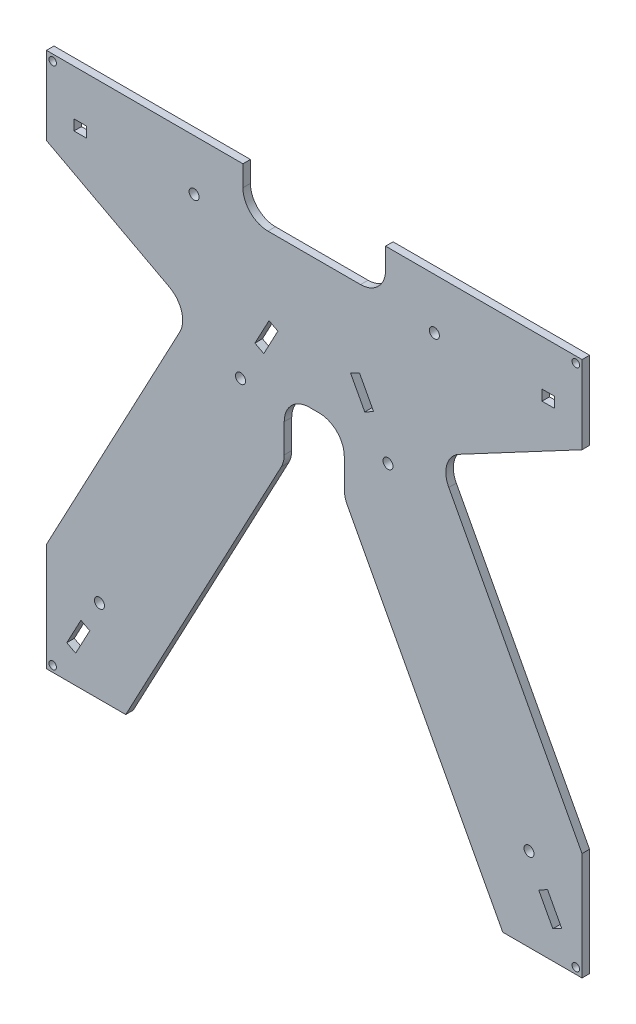
from build123d import *

# Parameters (mm, degrees)
SKETCH1_R           = 1.5
SKETCH1_R_2         = 2
SKETCH1_W           = 5
SKETCH1_H           = 4.2
BOSS_EXTRUDE1_DEPTH = 3
SKETCH3_W           = 57
SKETCH3_H           = 18.3
CUT_EXTRUDE2_DEPTH  = 152.350586388
FILLET1_R           = 10


with BuildPart() as part:
    # Sketch1 → Boss-Extrude1 (new body)
    with BuildSketch(Plane.XY):
        Polygon((89, 107), (107, 107), (107, -107), (-107, -107), (-107, 107), (-89, 107), align=None)
        with Locations((-104.5, 104.5)):
            Circle(SKETCH1_R, mode=Mode.SUBTRACT)
        with Locations((104.5, 104.5)):
            Circle(SKETCH1_R, mode=Mode.SUBTRACT)
        with Locations((104.5, 0)):
            Circle(SKETCH1_R, mode=Mode.SUBTRACT)
        with Locations((-48, 86.7)):
            Circle(SKETCH1_R_2, mode=Mode.SUBTRACT)
        with Locations((0, 104.5)):
            Circle(SKETCH1_R, mode=Mode.SUBTRACT)
        with Locations((104.5, -104.5)):
            Circle(SKETCH1_R, mode=Mode.SUBTRACT)
        Circle(SKETCH1_R_2, mode=Mode.SUBTRACT)
        with Locations((0, -104.5)):
            Circle(SKETCH1_R, mode=Mode.SUBTRACT)
        with Locations((-104.5, -104.5)):
            Circle(SKETCH1_R, mode=Mode.SUBTRACT)
        with Locations((-104.5, 0)):
            Circle(SKETCH1_R, mode=Mode.SUBTRACT)
        with Locations((48, 86.7)):
            Circle(SKETCH1_R_2, mode=Mode.SUBTRACT)
        with Locations((29.454403004, 32.277770019)):
            Circle(SKETCH1_R_2, mode=Mode.SUBTRACT)
        with Locations((85.823626955, -73.658581585)):
            Circle(SKETCH1_R_2, mode=Mode.SUBTRACT)
        with Locations((-85.823626955, -73.658581585)):
            Circle(SKETCH1_R_2, mode=Mode.SUBTRACT)
        with Locations((-29.454403004, 32.277770019)):
            Circle(SKETCH1_R_2, mode=Mode.SUBTRACT)
        with Locations((-93.5, 86.7)):
            Rectangle(SKETCH1_W, SKETCH1_H, mode=Mode.SUBTRACT)
        with Locations((93.5, 86.7)):
            Rectangle(SKETCH1_W, SKETCH1_H, mode=Mode.SUBTRACT)
        Polygon((93.22615521, -83.312729679), (98.863077605, -93.90636484), (95.331865885, -95.785338971), (89.69494349, -85.191703811), align=None, mode=Mode.SUBTRACT)
        Polygon((18.067189942, 57.935739126), (23.704112337, 47.342103966), (20.172900617, 45.463129834), (14.535978222, 56.056764994), align=None, mode=Mode.SUBTRACT)
        Polygon((-93.22615521, -83.312729679), (-89.69494349, -85.191703811), (-95.331865885, -95.785338971), (-98.863077605, -93.90636484), align=None, mode=Mode.SUBTRACT)
        Polygon((-18.067189942, 57.935739126), (-14.535978222, 56.056764994), (-20.172900617, 45.463129834), (-23.704112337, 47.342103966), align=None, mode=Mode.SUBTRACT)
    extrude(amount=BOSS_EXTRUDE1_DEPTH)

    # Sketch3 → Cut-Extrude2 (cut, through all)
    with BuildSketch(Plane.XY.offset(3)):
        Polygon((-12, 12), (-75.320451843, -107), (75.320451843, -107), (12, 12), (12, 36), (-12, 36), align=None)
        Polygon((-107, 75.787627262), (-49.056571617, 44.955660316), (-107, -63.939140288), align=None)
        Polygon((107, -63.939140288), (107, 75.787627262), (49.056571617, 44.955660316), align=None)
        with Locations((0, 97.85)):
            Rectangle(SKETCH3_W, SKETCH3_H)
    extrude(amount=-CUT_EXTRUDE2_DEPTH, mode=Mode.SUBTRACT)

    # Fillet1
    fillet1_edges = [part.edges().sort_by_distance(p)[0] for p in [
        (49.056571617, 44.955660316, 1.5),
        (12, 12, 1.5),
        (-12, 12, 1.5),
        (-12, 36, 1.5),
        (12, 36, 1.5),
        (-49.056571617, 44.955660316, 1.5),
        (-28.5, 88.7, 1.5),
        (28.5, 88.7, 1.5),
    ]]
    fillet(fillet1_edges, radius=FILLET1_R)


solid = part.part
